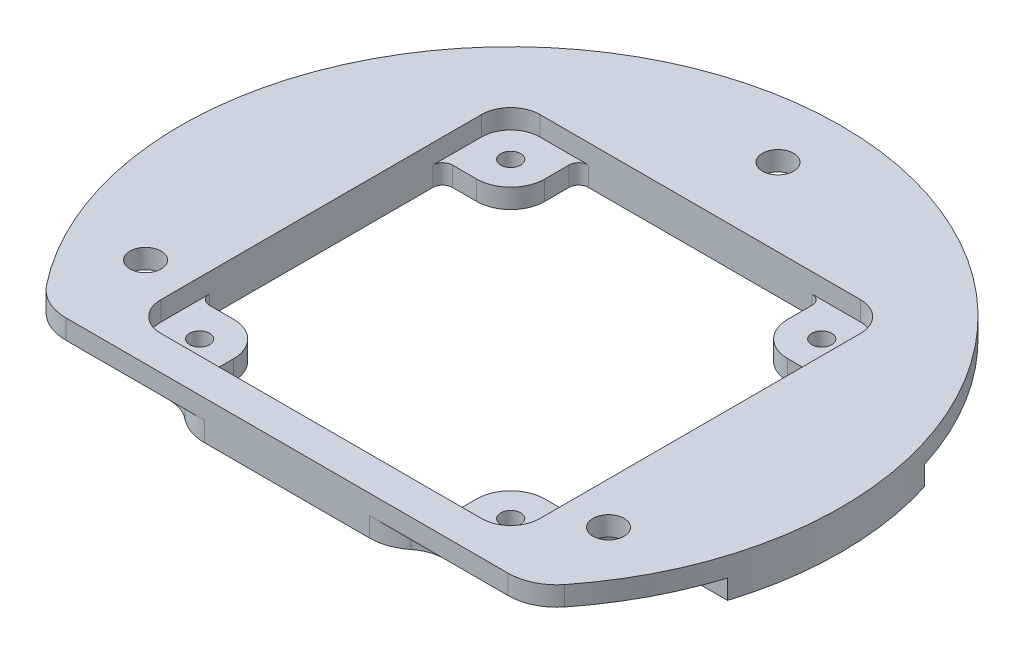
from build123d import *
from build123d.topology import SkipClean

# Parameters (mm, degrees)
SKETCH1_R                         = 34
BOSS_EXTRUDE1_DEPTH               = 2
M2_CLEARANCE_HOLE1_D              = 2.4
SKETCH11_W                        = 42
SKETCH11_H                        = 42
BOSS_EXTRUDE3_DEPTH               = 2
TAP_START                         = -2
TAP_DRILL_FOR_M2_5_TAP1_OUTLINE_R = 1.025
TAP_DRILL_FOR_M2_5_TAP1_DEPTH     = 4
CUT_EXTRUDE1_DEPTH                = 49.124837662
CUT_EXTRUDE1_DEPTH_BACK           = 2
SKETCH10_R                        = 1.6
SKETCH12_W                        = 39
SKETCH12_H                        = 39
CUT_EXTRUDE2_DEPTH                = 3
SKETCH13_R                        = 1.025
BOSS_EXTRUDE4_DEPTH               = 1
FILLET1_R                         = 1
FILLET2_R                         = 5
CUT_EXTRUDE3_DEPTH                = 49.176757882
BOSS_EXTRUDE5_START               = 2
BOSS_EXTRUDE5_DEPTH               = 2
FILLET3_R                         = 4
FILLET4_R                         = 2
FILLET5_R                         = 3
CUT_EXTRUDE4_DEPTH                = 49.124837662
CUT_EXTRUDE4_DEPTH_BACK           = 49.124837662
SKETCH16_W                        = 58.171472577
SKETCH16_H                        = 11
FILLET6_R                         = 5


# Read off the part's stored shape, not the designer's step: Tap Drill for M2.5 Tap1
with BuildPart() as part:
    # Sketch1 → Boss-Extrude1 (new body)
    with BuildSketch(Plane(origin=(0, 0, 0), x_dir=(1, 0, 0), z_dir=(0, 1, 0))):
        with Locations(Location((0, 0, 0), (0, 0, 270))):
            Circle(SKETCH1_R)
    extrude(amount=BOSS_EXTRUDE1_DEPTH)

    # M2 Clearance Hole1 (through all)
    with Locations(Plane(origin=(0, 2, 0), x_dir=(1, 0, 0), z_dir=(0, 1, 0))):
        with Locations((-23.815698604, -13.75), (0, 27.5), (23.815698604, -13.75)):
            Hole(M2_CLEARANCE_HOLE1_D / 2)

    # Sketch11 → Boss-Extrude3 (add)
    with BuildSketch(Plane.XZ):
        Rectangle(SKETCH11_W, SKETCH11_H)
    extrude(amount=BOSS_EXTRUDE3_DEPTH)

    # Tap Drill for M2.5 Tap1 outline → Tap Drill for M2.5 Tap1 (cut)
    with BuildSketch(Plane(origin=(0, 0, 0), x_dir=(1, 0, 0), z_dir=(0, 1, 0)).offset(TAP_START)):
        with Locations((-16, 16)):
            Circle(TAP_DRILL_FOR_M2_5_TAP1_OUTLINE_R)
        with Locations((16, -16)):
            Circle(TAP_DRILL_FOR_M2_5_TAP1_OUTLINE_R)
        with Locations((16, 16)):
            Circle(TAP_DRILL_FOR_M2_5_TAP1_OUTLINE_R)
        with Locations((-16, -16)):
            Circle(TAP_DRILL_FOR_M2_5_TAP1_OUTLINE_R)
    extrude(amount=TAP_DRILL_FOR_M2_5_TAP1_DEPTH, mode=Mode.SUBTRACT)

    # Sketch10 → Cut-Extrude1 (cut, two sides: drawn at the far end of the back side and taken through both)
    with BuildSketch(Plane.XZ.offset(-CUT_EXTRUDE1_DEPTH_BACK)):
        with Locations(Location((0, -27.5, 0), (0, 0, 90))):
            Circle(SKETCH10_R)
        with Locations(Location((-23.815698604, 13.75, 0), (0, 0, 90))):
            Circle(SKETCH10_R)
        with Locations(Location((23.815698604, 13.75, 0), (0, 0, 90))):
            Circle(SKETCH10_R)
    extrude(amount=CUT_EXTRUDE1_DEPTH + CUT_EXTRUDE1_DEPTH_BACK, mode=Mode.SUBTRACT)

    # Sketch12 → Cut-Extrude2 (cut)
    with BuildSketch(Plane(origin=(0, 2, 0), x_dir=(1, 0, 0), z_dir=(0, 1, 0))):
        Rectangle(SKETCH12_W, SKETCH12_H)
    extrude(amount=-CUT_EXTRUDE2_DEPTH, mode=Mode.SUBTRACT)

    # Sketch13 → Boss-Extrude4 (add)
    # profile 1 of 4: a face of its own
    with BuildSketch(Plane(origin=(0, -1, 0), x_dir=(1, 0, 0), z_dir=(0, 1, 0))):
        with BuildLine():
            Line((-12.5, 16), (-12.5, 19.5))
            Line((-12.5, 19.5), (-19.5, 19.5))
            Line((-19.5, 19.5), (-19.5, 12.5))
            Line((-19.5, 12.5), (-16, 12.5))
            ThreePointArc((-16, 12.5), (-13.525126266, 13.525126266), (-12.5, 16))
        make_face()
        with Locations(Location((-16, 16, 0), (0, 0, 270))):
            Circle(SKETCH13_R, mode=Mode.SUBTRACT)
    # profile 2 of 4: a face of its own
    with BuildSketch(Plane(origin=(0, -1, 0), x_dir=(1, 0, 0), z_dir=(0, 1, 0))):
        with BuildLine():
            Line((16, 12.5), (19.5, 12.5))
            Line((19.5, 12.5), (19.5, 19.5))
            Line((19.5, 19.5), (12.5, 19.5))
            Line((12.5, 19.5), (12.5, 16))
            ThreePointArc((12.5, 16), (13.525126266, 13.525126266), (16, 12.5))
        make_face()
        with Locations(Location((16, 16, 0), (0, 0, 270))):
            Circle(SKETCH13_R, mode=Mode.SUBTRACT)
    # profile 3 of 4: a face of its own
    with BuildSketch(Plane(origin=(0, -1, 0), x_dir=(1, 0, 0), z_dir=(0, 1, 0))):
        with BuildLine():
            Line((12.5, -16), (12.5, -19.5))
            Line((12.5, -19.5), (19.5, -19.5))
            Line((19.5, -19.5), (19.5, -12.5))
            Line((19.5, -12.5), (16, -12.5))
            ThreePointArc((16, -12.5), (13.525126266, -13.525126266), (12.5, -16))
        make_face()
        with Locations(Location((16, -16, 0), (0, 0, 270))):
            Circle(SKETCH13_R, mode=Mode.SUBTRACT)
    # profile 4 of 4: a face of its own
    with BuildSketch(Plane(origin=(0, -1, 0), x_dir=(1, 0, 0), z_dir=(0, 1, 0))):
        with BuildLine():
            Line((-16, -12.5), (-19.5, -12.5))
            Line((-19.5, -12.5), (-19.5, -19.5))
            Line((-19.5, -19.5), (-12.5, -19.5))
            Line((-12.5, -19.5), (-12.5, -16))
            ThreePointArc((-12.5, -16), (-13.525126266, -13.525126266), (-16, -12.5))
        make_face()
        with Locations(Location((-16, -16, 0), (0, 0, 270))):
            Circle(SKETCH13_R, mode=Mode.SUBTRACT)
    extrude(amount=BOSS_EXTRUDE4_DEPTH)

    # Fillet1
    fillet1_edges = [part.edges().sort_by_distance(p)[0] for p in [
        (-12.5, -0.5, -19.5),
        (-19.5, -0.5, -12.5),
        (19.5, -0.5, -12.5),
        (12.5, -0.5, -19.5),
        (12.5, -0.5, 19.5),
        (19.5, -0.5, 12.5),
        (-19.5, -0.5, 12.5),
        (-12.5, -0.5, 19.5),
    ]]
    fillet(fillet1_edges, radius=FILLET1_R)

    # Fillet2
    fillet2_edges = [part.edges().sort_by_distance(p)[0] for p in [
        (21, -1, -21),
        (21, -1, 21),
        (-21, -1, 21),
        (-21, -1, -21),
    ]]
    fillet(fillet2_edges, radius=FILLET2_R)

    # Sketch14 → Cut-Extrude3 (cut, through all)
    with BuildSketch(Plane(origin=(0, -1, 0), x_dir=(1, 0, 0), z_dir=(0, 1, 0))):
        with BuildLine():
            Line((12.5, 16), (12.5, 18.5))
            ThreePointArc((12.5, 18.5), (12.207106781, 19.207106781), (11.5, 19.5))
            Line((11.5, 19.5), (-11.5, 19.5))
            ThreePointArc((-11.5, 19.5), (-12.207106781, 19.207106781), (-12.5, 18.5))
            Line((-12.5, 18.5), (-12.5, 16))
            ThreePointArc((-12.5, 16), (-13.525126266, 13.525126266), (-16, 12.5))
            Line((-16, 12.5), (-18.5, 12.5))
            ThreePointArc((-18.5, 12.5), (-19.207106781, 12.207106781), (-19.5, 11.5))
            Line((-19.5, 11.5), (-19.5, -11.5))
            ThreePointArc((-19.5, -11.5), (-19.207106781, -12.207106781), (-18.5, -12.5))
            Line((-18.5, -12.5), (-16, -12.5))
            ThreePointArc((-16, -12.5), (-13.525126266, -13.525126266), (-12.5, -16))
            Line((-12.5, -16), (-12.5, -18.5))
            ThreePointArc((-12.5, -18.5), (-12.207106781, -19.207106781), (-11.5, -19.5))
            Line((-11.5, -19.5), (11.5, -19.5))
            ThreePointArc((11.5, -19.5), (12.207106781, -19.207106781), (12.5, -18.5))
            Line((12.5, -18.5), (12.5, -16))
            ThreePointArc((12.5, -16), (13.525126266, -13.525126266), (16, -12.5))
            Line((16, -12.5), (18.5, -12.5))
            ThreePointArc((18.5, -12.5), (19.207106781, -12.207106781), (19.5, -11.5))
            Line((19.5, -11.5), (19.5, 11.5))
            ThreePointArc((19.5, 11.5), (19.207106781, 12.207106781), (18.5, 12.5))
            Line((18.5, 12.5), (16, 12.5))
            ThreePointArc((16, 12.5), (13.525126266, 13.525126266), (12.5, 16))
        make_face()
    extrude(amount=-CUT_EXTRUDE3_DEPTH, mode=Mode.SUBTRACT)

    # Sketch15 → Boss-Extrude5 (add)
    with SkipClean():  # the faces are left unmerged after this step: merging them gives an invalid solid
        with BuildSketch(Plane.XZ.offset(BOSS_EXTRUDE5_START)):
            with BuildLine():
                Line((-10.145024857, 32.451170559), (-10.145024857, 21))
                Line((-10.145024857, 21), (10.145024857, 21))
                Line((10.145024857, 21), (10.145024857, 32.451170559))
                ThreePointArc((10.145024857, 32.451170559), (0, 34), (-10.145024857, 32.451170559))
            make_face()
            with BuildLine():
                Line((-21, 10.145024857), (-32.451170559, 10.145024857))
                ThreePointArc((-32.451170559, 10.145024857), (-34, 0), (-32.451170559, -10.145024857))
                Line((-32.451170559, -10.145024857), (-21, -10.145024857))
                Line((-21, -10.145024857), (-21, 10.145024857))
            make_face()
            with BuildLine():
                Line((-11, -21), (-11, -32.171415884))
                ThreePointArc((-11, -32.171415884), (-9.510045859, -32.642901644), (-8, -33.045423284))
                Line((-8, -33.045423284), (-8, -21))
                Line((-8, -21), (-11, -21))
            make_face()
            with BuildLine():
                ThreePointArc((8, -33.045423284), (9.510045859, -32.642901644), (11, -32.171415884))
                Line((11, -32.171415884), (11, -21))
                Line((11, -21), (8, -21))
                Line((8, -21), (8, -33.045423284))
            make_face()
            with BuildLine():
                ThreePointArc((34, 0), (33.610562321, 5.131286437), (32.451170559, 10.145024857))
                Line((32.451170559, 10.145024857), (21, 10.145024857))
                Line((21, 10.145024857), (21, -10.145024857))
                Line((21, -10.145024857), (32.451170559, -10.145024857))
                ThreePointArc((32.451170559, -10.145024857), (33.610562321, -5.131286437), (34, 0))
            make_face()
        extrude(amount=-BOSS_EXTRUDE5_DEPTH)

    # Fillet3
    fillet3_edges = [part.edges().sort_by_distance(p)[0] for p in [
        (-10.145024857, -1, 21),
        (10.145024857, -1, 21),
        (-21, -1, -10.145024857),
        (-21, -1, 10.145024857),
        (21, -1, 10.145024857),
        (21, -1, -10.145024857),
    ]]
    fillet(fillet3_edges, radius=FILLET3_R)

    # Fillet4
    fillet4_edges = [part.edges().sort_by_distance(p)[0] for p in [
        (-8, -1, -21),
        (-11, -1, -21),
        (11, -1, -21),
        (8, -1, -21),
    ]]
    fillet(fillet4_edges, radius=FILLET4_R)

    # Fillet5
    fillet5_edges = [part.edges().sort_by_distance(p)[0] for p in [
        (-19.5, 1, -19.5),
        (19.5, 1, -19.5),
        (19.5, 1, 19.5),
        (-19.5, 1, 19.5),
    ]]
    fillet(fillet5_edges, radius=FILLET5_R)

    # Sketch16 → Cut-Extrude4 (cut, two sides: drawn at the far end of the back side and taken through both)
    with SkipClean():  # the faces are left unmerged after this step: merging them gives an invalid solid
        with BuildSketch(Plane.XZ.offset(-CUT_EXTRUDE4_DEPTH_BACK)):
            with Locations((-0.899558855, 28.5)):
                Rectangle(SKETCH16_W, SKETCH16_H)
        extrude(amount=CUT_EXTRUDE4_DEPTH + CUT_EXTRUDE4_DEPTH_BACK, mode=Mode.SUBTRACT)

    # Fillet6
    fillet6_edges = [part.edges().sort_by_distance(p)[0] for p in [
        (10.680923241, -1, 23),
        (-25.039968051, 1, 23),
        (25.039968051, 1, 23),
        (-10.680923241, -1, 23),
    ]]
    fillet(fillet6_edges, radius=FILLET6_R)


solid = part.part
